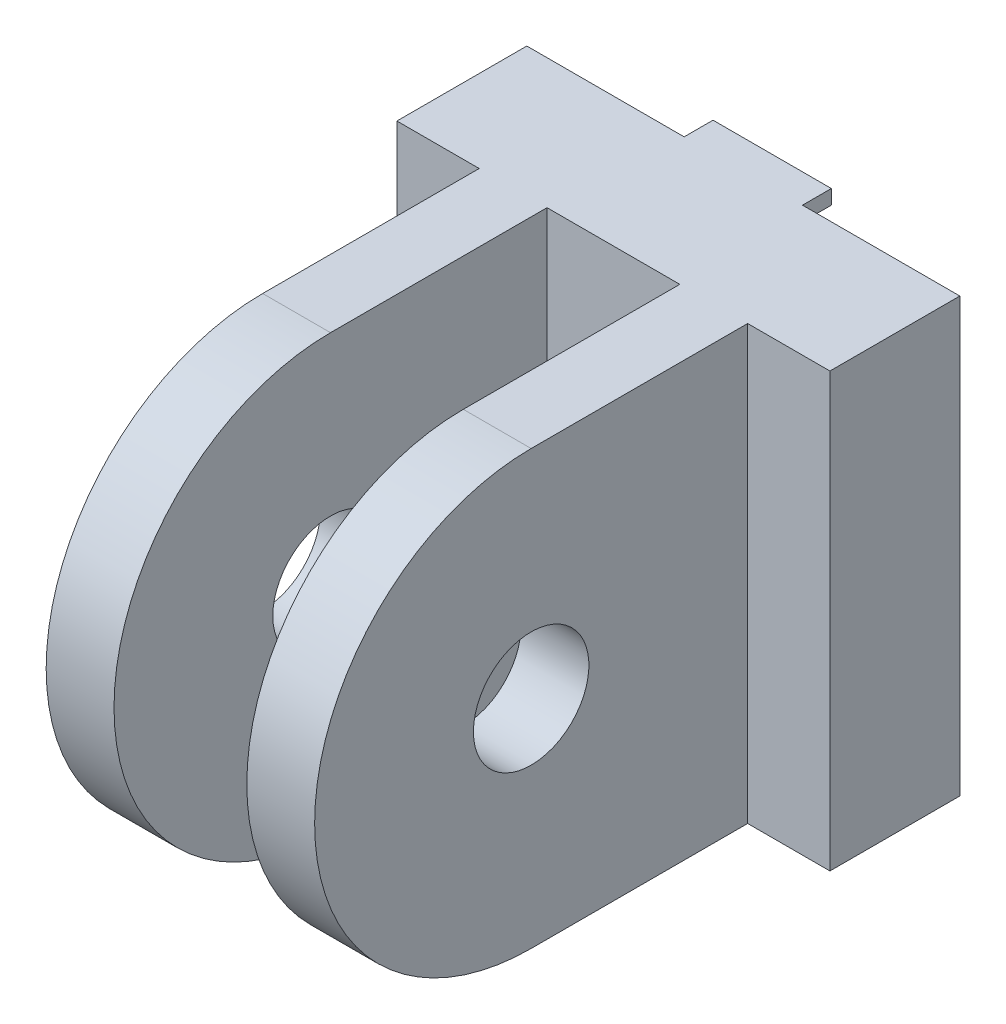
from build123d import *

# Parameters (mm, degrees)
SKETCH_1_W          = 30
SKETCH_1_H          = 30
EXTRUDE_1_DEPTH     = 9
SKETCH_2_W          = 4.7
SKETCH_2_H          = 30
EXTRUDE_2_DEPTH     = 30
CUT_EXTRUDE_START   = -18.6
CUT_EXTRUDE_2_DEPTH = 18.6
SKETCH_4_R          = 4
CUT_EXTRUDE_3_DEPTH = 49.337252715
SKETCH_6_R          = 4
CUT_EXTRUDE_5_DEPTH = 37.742346142
SKETCH_7_W          = 8.2
SKETCH_7_H          = 1
EXTRUDE_3_DEPTH     = 2


# Read off the part's stored shape, not the designer's step: 切除-拉伸2
with BuildPart() as part:
    # 草图1 → 凸台-拉伸1 (new body)
    with BuildSketch(Plane.XY):
        Rectangle(SKETCH_1_W, SKETCH_1_H)
    extrude(amount=EXTRUDE_1_DEPTH)

    # 草图2 → 凸台-拉伸2 (add)
    with BuildSketch(Plane.XY.offset(9)):
        with Locations((-6.95, 0)):
            Rectangle(SKETCH_2_W, SKETCH_2_H)
        with Locations((6.95, 0)):
            Rectangle(SKETCH_2_W, SKETCH_2_H)
    extrude(amount=EXTRUDE_2_DEPTH)

    # 切除-拉伸2 outline → 切除-拉伸2 (cut)
    with BuildSketch(Plane.ZY.offset(9.3).offset(CUT_EXTRUDE_START)):
        with BuildLine():
            Line((39, 15), (24, 15))
            ThreePointArc((24, 15), (34.606601718, 10.606601718), (39, 0))
            Line((39, 0), (39, 15))
        make_face()
        with BuildLine():
            Line((39, -15), (39, 0))
            ThreePointArc((39, 0), (34.606601718, -10.606601718), (24, -15))
            Line((24, -15), (39, -15))
        make_face()
    extrude(amount=CUT_EXTRUDE_2_DEPTH, mode=Mode.SUBTRACT)

    # 草图4 → 切除-拉伸3 (cut, through all)
    with BuildSketch(Plane.ZY.offset(9.3)):
        with Locations((24, 0)):
            Circle(SKETCH_4_R)
    extrude(amount=-CUT_EXTRUDE_3_DEPTH, mode=Mode.SUBTRACT)

    # 草图6 → 切除-拉伸5 (cut, through all)
    with BuildSketch(Plane.XY.offset(9)):
        Circle(SKETCH_6_R)
    extrude(amount=-CUT_EXTRUDE_5_DEPTH, mode=Mode.SUBTRACT)

    # 草图7 → 凸台-拉伸3 (add)
    with BuildSketch(Plane(origin=(0, 0, 0), x_dir=(-1, 0, 0), z_dir=(0, 0, -1))):
        with Locations((0, 14.5)):
            Rectangle(SKETCH_7_W, SKETCH_7_H)
        with Locations((0, -14.5)):
            Rectangle(SKETCH_7_W, SKETCH_7_H)
    extrude(amount=EXTRUDE_3_DEPTH)


solid = part.part
